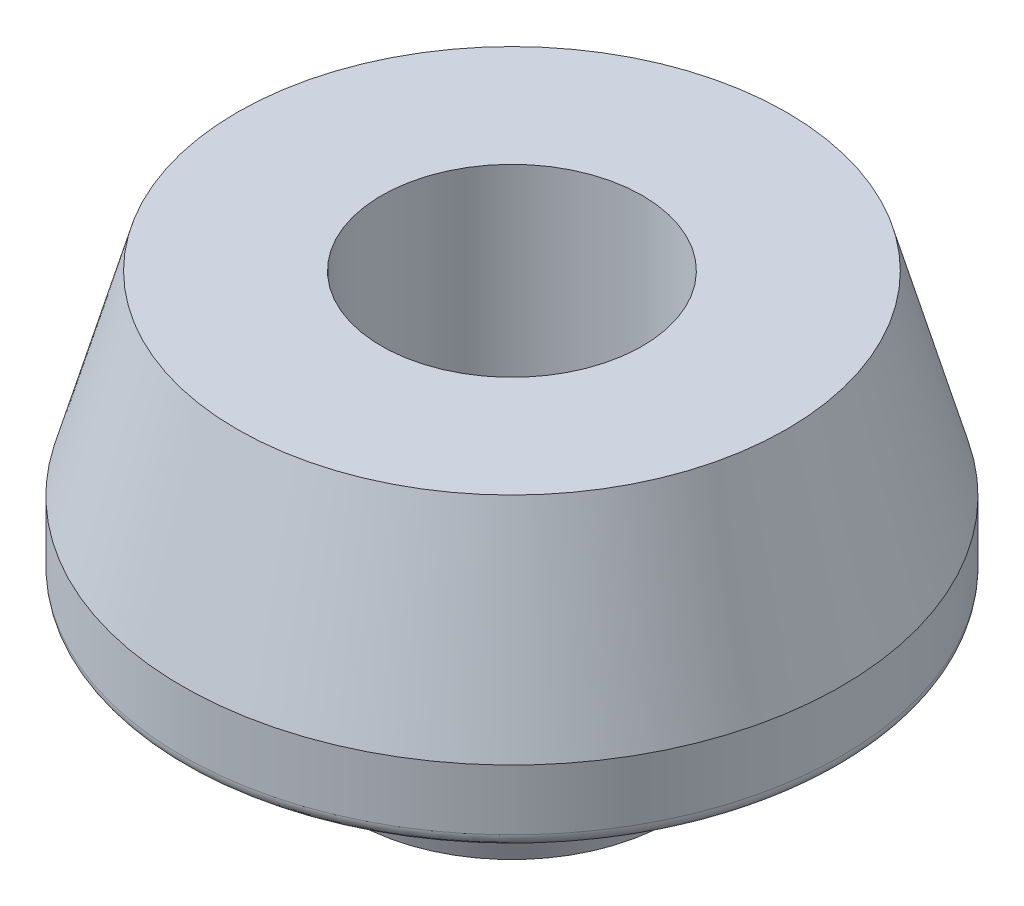
from build123d import *

# Parameters (mm, degrees)
FILLET1_R = 0.5


with BuildPart() as part:
    # Sketch1 → Revolve1 (revolve)
    with BuildSketch(Plane.XY):
        Polygon((10, 0), (4.75, 0), (4.75, -14.5), (5.75, -14.5), (7, -9.8), (12, -9.8), (12, -7.1), align=None)
    revolve(axis=Axis((0, -14.5, 0), (0, 1, 0)))

    # Fillet1
    fillet1_edges = [part.edges().sort_by_distance(p)[0] for p in [
        (-12, -9.8, 0),
    ]]
    fillet(fillet1_edges, radius=FILLET1_R)


solid = part.part
